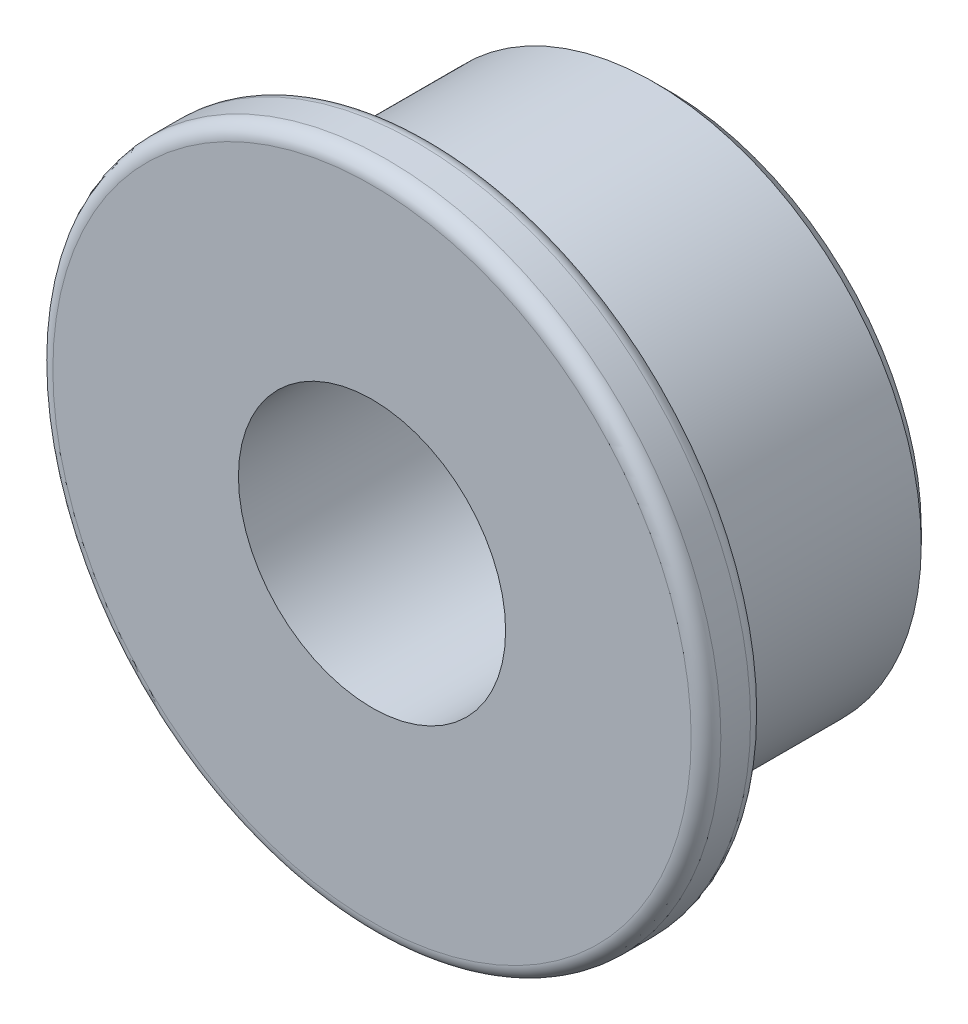
from build123d import *

# Parameters (mm, degrees)
SKETCH1_R           = 9
SKETCH1_R_2         = 4.5
BOSS_EXTRUDE1_DEPTH = 8
BOSS_EXTRUDE2_START = 2
SKETCH2_R           = 11.25
SKETCH2_R_2         = 4.5
BOSS_EXTRUDE2_DEPTH = 2
FILLET1_R           = 0.5
FILLET2_R           = 0.5
FILLET3_R           = 0.8
CHAMFER1_SIZE       = 0.5


with BuildPart() as part:
    # Sketch1 → Boss-Extrude1 (new body)
    with BuildSketch(Plane.XY):
        Circle(SKETCH1_R)
        Circle(SKETCH1_R_2, mode=Mode.SUBTRACT)
    extrude(amount=-BOSS_EXTRUDE1_DEPTH)

    # Sketch2 → Boss-Extrude2 (add)
    with BuildSketch(Plane.XY.offset(BOSS_EXTRUDE2_START)):
        Circle(SKETCH2_R)
        Circle(SKETCH2_R_2, mode=Mode.SUBTRACT)
    extrude(amount=-BOSS_EXTRUDE2_DEPTH)

    # Fillet1
    fillet1_edges = [part.edges().sort_by_distance(p)[0] for p in [
        (-11.25, 0, 2),
    ]]
    fillet(fillet1_edges, radius=FILLET1_R)

    # Fillet2
    fillet2_edges = [part.edges().sort_by_distance(p)[0] for p in [
        (-11.25, 0, 0),
    ]]
    fillet(fillet2_edges, radius=FILLET2_R)

    # Fillet3
    fillet3_edges = [part.edges().sort_by_distance(p)[0] for p in [
        (-9, 0, 0),
    ]]
    fillet(fillet3_edges, radius=FILLET3_R)

    # Chamfer1
    chamfer1_edges = [part.edges().sort_by_distance(p)[0] for p in [
        (-9, 0, -8),
    ]]
    chamfer(chamfer1_edges, length=CHAMFER1_SIZE)


solid = part.part
